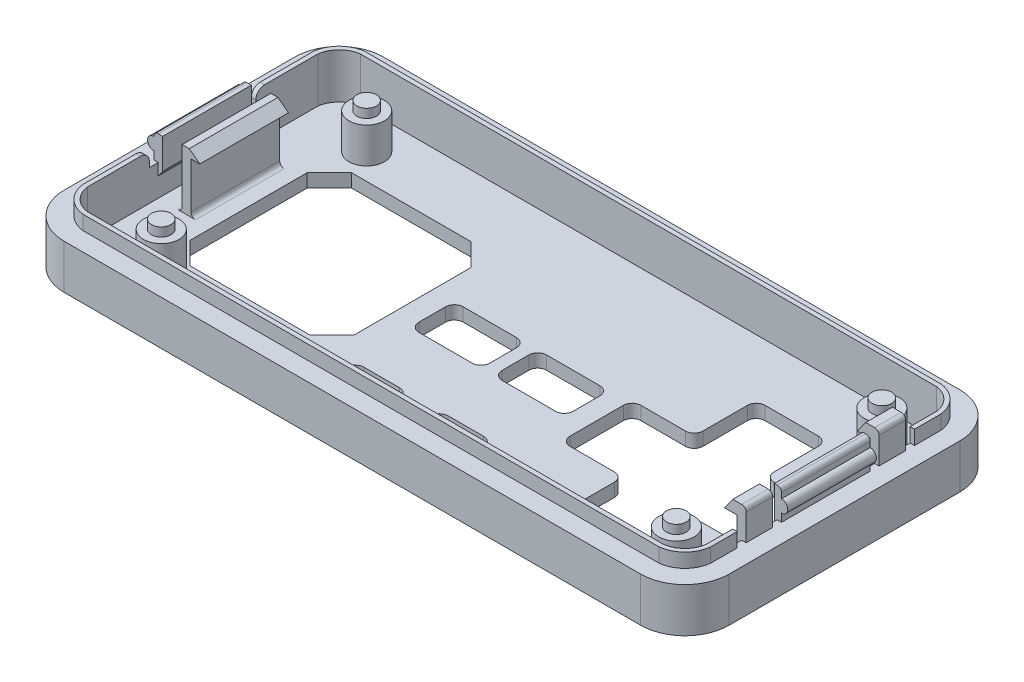
from build123d import *

# Parameters (mm, degrees)
EXTRUDE_2_DEPTH       = 5
EXTRUDE_4_DEPTH       = 1.6
SKETCH_7_W            = 0.5
SKETCH_7_H            = 10
EXTRUDE_8_DEPTH       = 2.8
SKETCH_8_R            = 0.7
EXTRUDE_9_DEPTH       = 10
FILLET_1_R            = 0.5
SKETCH_11_W           = 1
SKETCH_11_H           = 1.6
CUT_EXTRUDE_1_DEPTH   = 1.2
FILLET_2_R            = 1
SKETCH_13_W           = 0.5
SKETCH_13_H           = 10
EXTRUDE_10_DEPTH      = 2.8
CUT_EXTRUDE_START     = -3.5
CUT_EXTRUDE_2_DEPTH   = 3.5
SKETCH_13_2_W         = 0.5
SKETCH_13_2_H         = 10
EXTRUDE_11_DEPTH      = 2
EXTRUDE_12_DEPTH      = 1.6
EXTRUDE_12_DEPTH_BACK = 2
SKETCH_5_W            = 0.3
SKETCH_5_H            = 10
SKETCH_15_R           = 2
EXTRUDE_13_DEPTH      = 4
SKETCH_17_W           = 0.5
SKETCH_17_H           = 1
CUT_EXTRUDE_3_DEPTH   = 1.6
SKETCH_19_W           = 0.8
SKETCH_19_H           = 10
EXTRUDE_15_DEPTH      = 1.8
SKETCH_20_R           = 0.7
EXTRUDE_16_DEPTH      = 10
FILLET_4_R            = 0.5
SKETCH_21_W           = 0.5
SKETCH_21_H           = 3
EXTRUDE_17_DEPTH      = 1.9
SKETCH_22_W           = 3
SKETCH_22_H           = 6.3
EXTRUDE_23_DEPTH      = 0.5
FILLET_12_R           = 0.5
SKETCH_29_W           = 0.5
SKETCH_29_H           = 1
CUT_EXTRUDE_5_DEPTH   = 1.6
SKETCH_30_W           = 3
SKETCH_30_H           = 1.3
EXTRUDE_26_DEPTH      = 1.5
CHAMFER_7_SIZE        = 1
CHAMFER_7_SIZE_2      = 1.37638192
SKETCH_24_W           = 1
SKETCH_24_H           = 10
EXTRUDE_27_DEPTH      = 6.6
FILLET_14_R           = 0.5
SKETCH_31_W           = 10
SKETCH_31_H           = 0.9
EXTRUDE_29_DEPTH      = 1
CHAMFER_9_SIZE        = 1.2
CHAMFER_9_SIZE_2      = 0.90426486
CHAMFER_10_SIZE       = 1
CHAMFER_10_SIZE_2     = 1.37638192
CHAMFER_11_SIZE       = 1
CHAMFER_11_SIZE_2     = 1.37638192
SKETCH_37_R           = 1.1
EXTRUDE_30_DEPTH      = 1
SKETCH_38_W           = 18.5
SKETCH_38_H           = 18.2
CUT_EXTRUDE_6_DEPTH   = 2
CHAMFER_12_SIZE       = 2.5
SKETCH_39_W           = 8
SKETCH_39_H           = 5
SKETCH_39_W_2         = 6
SKETCH_39_H_2         = 4
CUT_EXTRUDE_7_DEPTH   = 2
FILLET_15_R           = 1
CUT_EXTRUDE_8_DEPTH   = 2
FILLET_16_R           = 1
CUT_EXTRUDE_START_2   = -0.8
CUT_EXTRUDE_9_DEPTH   = 0.8


# Read off the part's stored shape, not the designer's step: 切除-拉伸9
# Some blends are built 0.0001 mm under size
with BuildPart() as part:
    # case 2 → 凸台-拉伸2 (new body)
    with BuildSketch(Plane(origin=(0, 0, 0), x_dir=(1, 0, 0), z_dir=(0, 1, 0))):
        with BuildLine():
            Line((-34.042196447, 18), (30.957803553, 18))
            ThreePointArc((30.957803553, 18), (34.493337459, 16.535533906), (35.957803553, 13))
            Line((35.957803553, 13), (35.957803553, -13))
            ThreePointArc((35.957803553, -13), (34.493337459, -16.535533906), (30.957803553, -18))
            Line((30.957803553, -18), (-34.042196447, -18))
            ThreePointArc((-34.042196447, -18), (-37.577730353, -16.535533906), (-39.042196447, -13))
            Line((-39.042196447, -13), (-39.042196447, 13))
            ThreePointArc((-39.042196447, 13), (-37.577730353, 16.535533906), (-34.042196447, 18))
        make_face()
    extrude(amount=EXTRUDE_2_DEPTH)

    # 草图3 → 凸台-拉伸4 (add)
    with BuildSketch(Plane(origin=(0, 5, 0), x_dir=(1, 0, 0), z_dir=(0, 1, 0))):
        with BuildLine():
            Line((-36.942196447, 13), (-36.942196447, -13))
            ThreePointArc((-36.942196447, -13), (-35.997398295, -14.955201848), (-34.042196447, -15.9))
            Line((-34.042196447, -15.9), (30.957803553, -15.9))
            ThreePointArc((30.957803553, -15.9), (32.913005401, -14.955201848), (33.857803553, -13))
            Line((33.857803553, -13), (33.857803553, 13))
            ThreePointArc((33.857803553, 13), (32.913005401, 14.955201848), (30.957803553, 15.9))
            Line((30.957803553, 15.9), (-34.042196447, 15.9))
            ThreePointArc((-34.042196447, 15.9), (-35.997398295, 14.955201848), (-36.942196447, 13))
        make_face()
        with BuildLine():
            Line((-34.042196447, -15.4), (30.957803553, -15.4))
            ThreePointArc((30.957803553, -15.4), (32.562900965, -14.605097413), (33.357803553, -13))
            Line((33.357803553, -13), (33.357803553, 13))
            ThreePointArc((33.357803553, 13), (32.562900965, 14.605097413), (30.957803553, 15.4))
            Line((30.957803553, 15.4), (-34.042196447, 15.4))
            ThreePointArc((-34.042196447, 15.4), (-35.64729386, 14.605097413), (-36.442196447, 13))
            Line((-36.442196447, 13), (-36.442196447, -13))
            ThreePointArc((-36.442196447, -13), (-35.64729386, -14.605097413), (-34.042196447, -15.4))
        make_face(mode=Mode.SUBTRACT)
    extrude(amount=EXTRUDE_4_DEPTH)

    # 草图7 → 凸台-拉伸8 (add)
    with BuildSketch(Plane(origin=(0, 5, 0), x_dir=(1, 0, 0), z_dir=(0, 1, 0))):
        with Locations((-36.692196447, 0)):
            Rectangle(SKETCH_7_W, SKETCH_7_H)
    extrude(amount=EXTRUDE_8_DEPTH)

    # 草图8 → 凸台-拉伸9 (add)
    with BuildSketch(Plane.XY.offset(5)):
        with Locations((-36.942196447, 6.6)):
            Circle(SKETCH_8_R)
    extrude(amount=-EXTRUDE_9_DEPTH)

    # 圆角1
    fillet_1_edges = [part.edges().sort_by_distance(p)[0] for p in [
        (-36.942196447, 7.8, 0),
    ]]
    fillet(fillet_1_edges, radius=FILLET_1_R - 0.0001)  # a hair under: the kernel refuses the full size

    # 草图11 → 切除-拉伸1 (cut)
    with BuildSketch(Plane.ZY.offset(36.942196447)):
        with Locations((5.5, 5.8)):
            Rectangle(SKETCH_11_W, SKETCH_11_H)
        with Locations((-5.5, 5.8)):
            Rectangle(SKETCH_11_W, SKETCH_11_H)
    extrude(amount=-CUT_EXTRUDE_1_DEPTH, mode=Mode.SUBTRACT)

    # 圆角2
    fillet_2_edges = [part.edges().sort_by_distance(p)[0] for p in [
        (-36.692196447, 6.6, 6),
        (-36.692196447, 6.6, -6),
    ]]
    fillet(fillet_2_edges, radius=FILLET_2_R)

    # 草图13 → 凸台-拉伸10 (add)
    with BuildSketch(Plane(origin=(0, 5, 0), x_dir=(1, 0, 0), z_dir=(0, 1, 0))):
        with Locations((-36.192196447, 0)):
            Rectangle(SKETCH_13_W, SKETCH_13_H)
    extrude(amount=EXTRUDE_10_DEPTH)

    # 草图14 → 切除-拉伸2 (cut)
    with BuildSketch(Plane(origin=(0, 5, 0), x_dir=(1, 0, 0), z_dir=(0, 1, 0)).offset(CUT_EXTRUDE_START)):
        with BuildLine():
            Line((-34.042196447, -15.4), (30.957803553, -15.4))
            ThreePointArc((30.957803553, -15.4), (32.562900965, -14.605097413), (33.357803553, -13))
            Line((33.357803553, -13), (33.357803553, 13))
            ThreePointArc((33.357803553, 13), (32.562900965, 14.605097413), (30.957803553, 15.4))
            Line((30.957803553, 15.4), (-34.042196447, 15.4))
            ThreePointArc((-34.042196447, 15.4), (-35.64729386, 14.605097413), (-36.442196447, 13))
            Line((-36.442196447, 13), (-36.442196447, -13))
            ThreePointArc((-36.442196447, -13), (-35.64729386, -14.605097413), (-34.042196447, -15.4))
        make_face()
    extrude(amount=CUT_EXTRUDE_2_DEPTH, mode=Mode.SUBTRACT)

    # 草图13<2> → 凸台-拉伸11 (add)
    with BuildSketch(Plane(origin=(0, 5, 0), x_dir=(1, 0, 0), z_dir=(0, 1, 0))):
        with Locations((-36.192196447, 0)):
            Rectangle(SKETCH_13_2_W, SKETCH_13_2_H)
    extrude(amount=-EXTRUDE_11_DEPTH)

    # 草图5 → 凸台-拉伸12 (add, two sides: drawn at the far end of the back side and taken through both)
    with BuildSketch(Plane(origin=(0, 5, 0), x_dir=(1, 0, 0), z_dir=(0, 1, 0)).offset(-EXTRUDE_12_DEPTH_BACK)):
        with Locations((33.207803553, 0)):
            Rectangle(SKETCH_5_W, SKETCH_5_H)
    extrude(amount=EXTRUDE_12_DEPTH + EXTRUDE_12_DEPTH_BACK)

    # 草图15 → 凸台-拉伸13 (add)
    with BuildSketch(Plane(origin=(0, 1.5, 0), x_dir=(1, 0, 0), z_dir=(0, 1, 0))):
        with Locations(Location((-29.253680869, 11.322457703, 0), (0, 0, 270))):
            Circle(SKETCH_15_R)
        with Locations(Location((28.846319131, 11.322457703, 0), (0, 0, 270))):
            Circle(SKETCH_15_R)
        with Locations(Location((28.846319131, -11.847542297, 0), (0, 0, 270))):
            Circle(SKETCH_15_R)
        with Locations(Location((-29.253680869, -11.847542297, 0), (0, 0, 270))):
            Circle(SKETCH_15_R)
    extrude(amount=EXTRUDE_13_DEPTH)

    # 草图17 → 切除-拉伸3 (cut)
    with BuildSketch(Plane(origin=(0, 6.6, 0), x_dir=(1, 0, 0), z_dir=(0, 1, 0))):
        with Locations((33.607803553, -5.5)):
            Rectangle(SKETCH_17_W, SKETCH_17_H)
        with Locations((33.607803553, 5.5)):
            Rectangle(SKETCH_17_W, SKETCH_17_H)
    extrude(amount=-CUT_EXTRUDE_3_DEPTH, mode=Mode.SUBTRACT)

    # 草图19 → 凸台-拉伸15 (add)
    with BuildSketch(Plane(origin=(0, 6.6, 0), x_dir=(1, 0, 0), z_dir=(0, 1, 0))):
        with Locations((33.457803553, 0)):
            Rectangle(SKETCH_19_W, SKETCH_19_H)
    extrude(amount=EXTRUDE_15_DEPTH)

    # 草图20 → 凸台-拉伸16 (add)
    with BuildSketch(Plane(origin=(0, 0, -5), x_dir=(-1, 0, 0), z_dir=(0, 0, -1))):
        with Locations((-33.857803553, 6.6)):
            Circle(SKETCH_20_R)
    extrude(amount=-EXTRUDE_16_DEPTH)

    # 圆角4
    fillet_4_edges = [part.edges().sort_by_distance(p)[0] for p in [
        (33.857803553, 8.4, 0),
    ]]
    fillet(fillet_4_edges, radius=FILLET_4_R)

    # 草图21 → 凸台-拉伸17 (add)
    with BuildSketch(Plane(origin=(0, 6.6, 0), x_dir=(1, 0, 0), z_dir=(0, 1, 0))):
        with Locations((33.607803553, -7.5)):
            Rectangle(SKETCH_21_W, SKETCH_21_H)
        with Locations((33.607803553, 7.5)):
            Rectangle(SKETCH_21_W, SKETCH_21_H)
    extrude(amount=EXTRUDE_17_DEPTH)

    # 草图22 → 凸台-拉伸23 (add)
    with BuildSketch(Plane.ZY.offset(-33.357803553)):
        with Locations((-7.5, 5.35)):
            Rectangle(SKETCH_22_W, SKETCH_22_H)
        with Locations((7.5, 5.35)):
            Rectangle(SKETCH_22_W, SKETCH_22_H)
    extrude(amount=EXTRUDE_23_DEPTH)

    # 圆角12
    fillet_12_edges = [part.edges().sort_by_distance(p)[0] for p in [
        (33.857803553, 8.5, 7.5),
        (33.857803553, 8.5, -7.5),
    ]]
    fillet(fillet_12_edges, radius=FILLET_12_R)

    # 草图29 → 切除-拉伸5 (cut)
    with BuildSketch(Plane(origin=(0, 6.6, 0), x_dir=(1, 0, 0), z_dir=(0, 1, 0))):
        with Locations((33.607803553, -9.5)):
            Rectangle(SKETCH_29_W, SKETCH_29_H)
        with Locations((33.607803553, 9.5)):
            Rectangle(SKETCH_29_W, SKETCH_29_H)
    extrude(amount=-CUT_EXTRUDE_5_DEPTH, mode=Mode.SUBTRACT)

    # 草图30 → 凸台-拉伸26 (add)
    with BuildSketch(Plane.ZY.offset(-32.857803553)):
        with Locations((7.5, 7.85)):
            Rectangle(SKETCH_30_W, SKETCH_30_H)
        with Locations((-7.5, 7.85)):
            Rectangle(SKETCH_30_W, SKETCH_30_H)
    extrude(amount=EXTRUDE_26_DEPTH)

    # 倒角7
    # the kernel refuses this chamfer: 1.37638192, 1 mm, written as the material it takes off along each edge
    with BuildSketch(Plane(origin=(31.357803553, 8.5, -12.553227563), x_dir=(0.9990705747005861, 0.04310437063037558, 0), z_dir=(0, 0, 1)), Plane(origin=(31.357803553, 8.5, 2.446772437), x_dir=(0.9990705747005861, 0.04310437063037558, 0), z_dir=(0, 0, 1))) as chamfer_7_piece_1:
        Polygon((CHAMFER_7_SIZE * 0.999070574701, -CHAMFER_7_SIZE * 0.0431043706304), (-CHAMFER_7_SIZE_2 * 0.0431043706451, -CHAMFER_7_SIZE_2 * 0.999070575043), (0, 0), align=None)
    extrude(amount=10.106455125, mode=Mode.SUBTRACT)

    # 草图24 → 凸台-拉伸27 (add)
    with BuildSketch(Plane(origin=(0, 1.5, 0), x_dir=(1, 0, 0), z_dir=(0, 1, 0))):
        with Locations((-33.242196447, 0)):
            Rectangle(SKETCH_24_W, SKETCH_24_H)
    extrude(amount=EXTRUDE_27_DEPTH)

    # 圆角14
    fillet_14_edges = [part.edges().sort_by_distance(p)[0] for p in [
        (-33.742196447, 1.5, 0),
        (-32.742196447, 1.5, 0),
    ]]
    fillet(fillet_14_edges, radius=FILLET_14_R)

    # 草图31 → 凸台-拉伸29 (add)
    with BuildSketch(Plane(origin=(-32.742196447, 0, 0), x_dir=(0, 0, -1), z_dir=(1, 0, 0))):
        with Locations((0, 7.65)):
            Rectangle(SKETCH_31_W, SKETCH_31_H)
    extrude(amount=EXTRUDE_29_DEPTH)

    # 倒角9
    # the kernel refuses this chamfer: 1.2, 0.90426486 mm, written as the material it takes off along each edge
    with BuildSketch(Plane(origin=(-31.742196447, 8.1, 8.096678473), x_dir=(-0.9997280272590685, 0.023321052992757905, 0), z_dir=(0, 0, -1))) as chamfer_9_piece_1:
        Polygon((CHAMFER_9_SIZE * 0.999728027259, -CHAMFER_9_SIZE * 0.0233210529928), (-CHAMFER_9_SIZE_2 * 0.0233210529959, -CHAMFER_9_SIZE_2 * 0.999728027395), (0, 0), align=None)
    extrude(amount=16.193356947, mode=Mode.SUBTRACT)

    # 倒角10
    # the kernel refuses this chamfer: 1.37638192, 1 mm, written as the material it takes off along each edge
    with BuildSketch(Plane(origin=(32.857803553, 2.2, 12.553227563), x_dir=(0.9990705747005859, -0.04310437063037643, 0), z_dir=(0, 0, -1))) as chamfer_10_piece_1_section:
        Polygon((CHAMFER_10_SIZE * 0.999070574701, -CHAMFER_10_SIZE * 0.0431043706304), (-CHAMFER_10_SIZE_2 * 0.0431043706451, -CHAMFER_10_SIZE_2 * 0.999070575043), (0, 0), align=None)
    chamfer_10_piece_1 = extrude(amount=10.106455125, mode=Mode.PRIVATE)
    chamfer_10_piece_1 = split(chamfer_10_piece_1, bisect_by=Plane(origin=(33.357803553, 2.593003931, 7.5), z_dir=(-1, 0, 0)), keep=Keep.TOP, mode=Mode.PRIVATE)
    add(chamfer_10_piece_1, mode=Mode.SUBTRACT)
    with BuildSketch(Plane(origin=(33.057803553, 3, 8.553227563), x_dir=(0.9990705747005859, -0.04310437063037643, 0), z_dir=(0, 0, -1))) as chamfer_10_piece_2_section:
        Polygon((CHAMFER_10_SIZE * 0.999070574701, -CHAMFER_10_SIZE * 0.0431043706304), (-CHAMFER_10_SIZE_2 * 0.0431043706451, -CHAMFER_10_SIZE_2 * 0.999070575043), (0, 0), align=None)
    chamfer_10_piece_2 = extrude(amount=13.553227563, mode=Mode.PRIVATE)
    chamfer_10_piece_2 = split(chamfer_10_piece_2, bisect_by=Plane(origin=(33.357803553, 3.591034589, 0), z_dir=(-1, 0, 0)), keep=Keep.TOP, mode=Mode.PRIVATE)
    chamfer_10_piece_2 = split(chamfer_10_piece_2, bisect_by=Plane(origin=(33.198980023, 3.591034589, 6), z_dir=(0, 0, -1)), keep=Keep.TOP, mode=Mode.PRIVATE)
    add(chamfer_10_piece_2, mode=Mode.SUBTRACT)
    with BuildSketch(Plane(origin=(32.857803553, 2.2, -2.446772437), x_dir=(0.9990705747005859, -0.04310437063037643, 0), z_dir=(0, 0, -1))) as chamfer_10_piece_3_section:
        Polygon((CHAMFER_10_SIZE * 0.999070574701, -CHAMFER_10_SIZE * 0.0431043706304), (-CHAMFER_10_SIZE_2 * 0.0431043706451, -CHAMFER_10_SIZE_2 * 0.999070575043), (0, 0), align=None)
    chamfer_10_piece_3 = extrude(amount=10.106455125, mode=Mode.PRIVATE)
    chamfer_10_piece_3 = split(chamfer_10_piece_3, bisect_by=Plane(origin=(33.357803553, 3.100368512, -3.723386219), z_dir=(-1, 0, 0)), keep=Keep.TOP, mode=Mode.PRIVATE)
    add(chamfer_10_piece_3, mode=Mode.SUBTRACT)

    # 倒角11
    # the kernel refuses this chamfer: 1.37638192, 1 mm, written as the material it takes off along each edge
    with BuildSketch(Plane(origin=(-35.942196447, 3, 8.553227563), x_dir=(-0.9990705747005859, -0.04310437063037643, 0), z_dir=(0, 0, -1))) as chamfer_11_piece_1_section:
        Polygon((CHAMFER_11_SIZE * 0.999070574701, CHAMFER_11_SIZE * 0.0431043706304), (-CHAMFER_11_SIZE_2 * 0.0431043706451, CHAMFER_11_SIZE_2 * 0.999070575043), (0, 0), align=None)
    chamfer_11_piece_1 = extrude(amount=17.106455125, mode=Mode.PRIVATE)
    chamfer_11_piece_1 = split(chamfer_11_piece_1, bisect_by=Plane(origin=(-36.442196447, 3.546250957, 0), z_dir=(1, 0, 0)), keep=Keep.TOP, mode=Mode.PRIVATE)
    add(chamfer_11_piece_1, mode=Mode.SUBTRACT)

    # 草图37 → 凸台-拉伸30 (add)
    with BuildSketch(Plane(origin=(0, 5.5, 0), x_dir=(1, 0, 0), z_dir=(0, 1, 0))):
        with Locations(Location((28.846319131, 11.322457703, 0), (0, 0, 270))):
            Circle(SKETCH_37_R)
        with Locations(Location((-29.253680869, 11.322457703, 0), (0, 0, 270))):
            Circle(SKETCH_37_R)
        with Locations(Location((-29.253680869, -11.847542297, 0), (0, 0, 270))):
            Circle(SKETCH_37_R)
        with Locations(Location((28.846319131, -11.847542297, 0), (0, 0, 270))):
            Circle(SKETCH_37_R)
    extrude(amount=EXTRUDE_30_DEPTH)

    # 草图38 → 切除-拉伸6 (cut)
    with BuildSketch(Plane.XZ):
        with Locations((-21.292196447, 0.7)):
            Rectangle(SKETCH_38_W, SKETCH_38_H)
    extrude(amount=-CUT_EXTRUDE_6_DEPTH, mode=Mode.SUBTRACT)

    # 倒角12
    chamfer_12_edges = [part.edges().sort_by_distance(p)[0] for p in [
        (-30.542196447, 0.75, -8.4),
        (-30.542196447, 0.75, 9.8),
        (-12.042196447, 0.75, 9.8),
        (-12.042196447, 0.75, -8.4),
    ]]
    chamfer(chamfer_12_edges, length=CHAMFER_12_SIZE)

    # 草图39 → 切除-拉伸7 (cut)
    with BuildSketch(Plane.XZ):
        with Locations((-5.642196447, 0.9)):
            Rectangle(SKETCH_39_W, SKETCH_39_H)
        with Locations((3.757803553, 0.9)):
            Rectangle(SKETCH_39_W, SKETCH_39_H)
        with Locations((-6.342196447, 11.9)):
            Rectangle(SKETCH_39_W_2, SKETCH_39_H_2)
        with Locations((3.157803553, 11.9)):
            Rectangle(SKETCH_39_W_2, SKETCH_39_H_2)
    extrude(amount=-CUT_EXTRUDE_7_DEPTH, mode=Mode.SUBTRACT)

    # 圆角15
    fillet_15_edges = [part.edges().sort_by_distance(p)[0] for p in [
        (-0.242196447, 0.75, -1.6),
        (-0.242196447, 0.75, 3.4),
        (7.757803553, 0.75, 3.4),
        (7.757803553, 0.75, -1.6),
        (-9.342196447, 0.75, 9.9),
        (-9.342196447, 0.75, 13.9),
        (-3.342196447, 0.75, 13.9),
        (-3.342196447, 0.75, 9.9),
        (0.157803553, 0.75, 9.9),
        (0.157803553, 0.75, 13.9),
        (6.157803553, 0.75, 13.9),
        (6.157803553, 0.75, 9.9),
        (-9.642196447, 0.75, -1.6),
        (-9.642196447, 0.75, 3.4),
        (-1.642196447, 0.75, 3.4),
        (-1.642196447, 0.75, -1.6),
    ]]
    fillet(fillet_15_edges, radius=FILLET_15_R)

    # 草图41 → 切除-拉伸8 (cut)
    with BuildSketch(Plane.XZ):
        Polygon((17.007803553, 13), (25.007803553, 13), (25.007803553, 6), (32.007803553, 6), (32.007803553, -2), (25.007803553, -2), (25.007803553, -9), (17.007803553, -9), (17.007803553, -2), (10.007803553, -2), (10.007803553, 6), (17.007803553, 6), align=None)
    extrude(amount=-CUT_EXTRUDE_8_DEPTH, mode=Mode.SUBTRACT)

    # 圆角16
    fillet_16_edges = [part.edges().sort_by_distance(p)[0] for p in [
        (17.007803553, 0.75, 6),
        (17.007803553, 0.75, 13),
        (25.007803553, 0.75, 13),
        (25.007803553, 0.75, 6),
        (32.007803553, 0.75, 6),
        (32.007803553, 0.75, -2),
        (25.007803553, 0.75, -2),
        (25.007803553, 0.75, -9),
        (17.007803553, 0.75, -9),
        (17.007803553, 0.75, -2),
        (10.007803553, 0.75, -2),
        (10.007803553, 0.75, 6),
    ]]
    fillet(fillet_16_edges, radius=FILLET_16_R)

    # 切除-拉伸9 outline → 切除-拉伸9 (cut)
    with BuildSketch(Plane.XZ.offset(CUT_EXTRUDE_START_2)):
        with BuildLine():
            Line((30.087658574, -9.774806648), (29.800106724, -9.60705588))
            add(Edge.make_bspline(
                [(29.800106724, -9.60705588), (29.706230649, -9.555144922), (29.602408733, -9.527184429), (29.394716145, -9.527184429), (29.290869852, -9.555144922), (29.197018154, -9.60705588)],
                knots=[3, 3, 3, 3, 4, 4, 5, 5, 5, 5], degree=3))
            Line((29.197018154, -9.60705588), (28.909441927, -9.774806648))
            Line((28.909441927, -9.774806648), (27.417711857, -10.635499844))
            Line((27.417711857, -10.635499844), (27.13013563, -10.801251692))
            add(Edge.make_bspline(
                [(27.13013563, -10.801251692), (26.944431155, -10.909083636), (26.828591345, -11.108780546), (26.828591345, -11.322457703)],
                knots=[8, 8, 8, 8, 9, 9, 9, 9], degree=3))
            Line((26.828591345, -11.322457703), (26.828591345, -13.710837139))
            add(Edge.make_bspline(
                [(26.828591345, -13.710837139), (26.828591345, -13.926501027), (26.944431155, -14.124211206), (27.13013563, -14.23204315)],
                knots=[10, 10, 10, 10, 11, 11, 11, 11], degree=3))
            Line((27.13013563, -14.23204315), (27.417711857, -14.397794998))
            Line((27.417711857, -14.397794998), (28.909441927, -15.258488195))
            Line((28.909441927, -15.258488195), (29.197018154, -15.426226774))
            add(Edge.make_bspline(
                [(29.197018154, -15.426226774), (29.290869852, -15.48014884), (29.394716145, -15.506110413), (29.602408733, -15.506110413), (29.706230649, -15.48014884), (29.800106724, -15.426226774)],
                knots=[14, 14, 14, 14, 15, 15, 16, 16, 16, 16], degree=3))
            Line((29.800106724, -15.426226774), (30.087658574, -15.258488195))
            Line((30.087658574, -15.258488195), (31.579388644, -14.397794998))
            Line((31.579388644, -14.397794998), (31.866940494, -14.23204315))
            add(Edge.make_bspline(
                [(31.866940494, -14.23204315), (32.054668266, -14.124211206), (32.168484779, -13.926501027), (32.168484779, -13.710837139)],
                knots=[19, 19, 19, 19, 20, 20, 20, 20], degree=3))
            Line((32.168484779, -13.710837139), (32.168484779, -11.322457703))
            add(Edge.make_bspline(
                [(32.168484779, -11.322457703), (32.168484779, -11.108780546), (32.054668266, -10.909083636), (31.866940494, -10.801251692)],
                knots=[21, 21, 21, 21, 22, 22, 22, 22], degree=3))
            Line((31.866940494, -10.801251692), (31.579388644, -10.635499844))
            Line((31.579388644, -10.635499844), (30.087658574, -9.774806648))
        make_face()
        with BuildLine():
            add(Edge.make_bspline(
                [(30.223438822, -13.804688836), (30.451120602, -13.676879889), (30.558940357, -13.509141309), (30.558940357, -13.123727735), (30.435129248, -13.125726654), (30.211469683, -13.253523414)],
                knots=[0, 0, 0, 0, 1, 1, 2.031545133, 2.031545133, 2.031545133, 2.031545133], degree=3))
            Line((30.211469683, -13.253523414), (30.039733266, -13.349386219))
            add(Edge.make_bspline(
                [(30.019744073, -13.383331281), (30.019744073, -13.369351034), (30.02773975, -13.355370788), (30.039733266, -13.349386219)],
                knots=[4, 4, 4, 4, 5, 5, 5, 5], degree=3))
            Line((30.019744073, -13.383331281), (30.019744073, -14.909018601))
            add(Edge.make_bspline(
                [(29.999803634, -14.942963663), (30.013771692, -14.934980175), (30.019744073, -14.922998848), (30.019744073, -14.909018601)],
                knots=[3, 3, 3, 3, 4, 4, 4, 4], degree=3))
            Line((29.999803634, -14.942963663), (29.612378952, -15.162625389))
            add(Edge.make_bspline(
                [(29.554459047, -15.128680327), (29.554459047, -15.158639739), (29.586417379, -15.176605636), (29.612378952, -15.162625389)],
                knots=[5, 5, 5, 5, 6, 6, 6, 6], degree=3))
            Line((29.554459047, -15.128680327), (29.554459047, -13.279484987))
            add(Edge.make_bspline(
                [(29.574423863, -13.245539925), (29.560455805, -13.251524494), (29.554459047, -13.265504741), (29.554459047, -13.279484987)],
                knots=[7, 7, 7, 7, 8, 8, 8, 8], degree=3))
            Line((29.574423863, -13.245539925), (30.233433418, -12.872107678))
            add(Edge.make_bspline(
                [(30.233433418, -12.872107678), (30.660787732, -12.630470028), (31.014230786, -12.58254472), (31.014230786, -13.523121556), (30.656789893, -13.928499946), (30.247425853, -14.160155187)],
                knots=[9, 9, 9, 9, 10, 10, 10.962489192, 10.962489192, 10.962489192, 10.962489192], degree=3))
            Line((30.247425853, -14.160155187), (30.039733266, -14.27597062))
            Line((30.039733266, -14.27597062), (30.039733266, -13.896553803))
            Line((30.039733266, -13.896553803), (30.223438822, -13.804688836))
        make_face(mode=Mode.SUBTRACT)
        with BuildLine():
            add(Edge.make_bspline(
                [(31.615320437, -14.036344078), (31.627313952, -14.03034732), (31.635309629, -14.016367074), (31.635309629, -14.002386828)],
                knots=[0, 0, 0, 0, 1, 1, 1, 1], degree=3))
            Line((31.615320437, -14.036344078), (31.23191797, -14.254006885))
            add(Edge.make_bspline(
                [(31.173998065, -14.220061823), (31.173998065, -14.250009046), (31.205956397, -14.267987131), (31.23191797, -14.254006885)],
                knots=[2, 2, 2, 2, 3, 3, 3, 3], degree=3))
            Line((31.173998065, -14.220061823), (31.173998065, -13.339391622))
            add(Edge.make_bspline(
                [(31.193987258, -13.305446561), (31.181993742, -13.313430049), (31.173998065, -13.325423565), (31.173998065, -13.339391622)],
                knots=[4, 4, 4, 4, 5, 5, 5, 5], degree=3))
            Line((31.193987258, -13.305446561), (31.577389725, -13.089770485))
            add(Edge.make_bspline(
                [(31.635309629, -13.123727735), (31.635309629, -13.093768323), (31.603351298, -13.075802427), (31.577389725, -13.089770485)],
                knots=[6, 6, 6, 6, 7, 7, 7, 7], degree=3))
            Line((31.635309629, -13.123727735), (31.635309629, -14.002386828))
        make_face(mode=Mode.SUBTRACT)
        with BuildLine():
            add(Edge.make_bspline(
                [(31.405653307, -12.50466), (31.249908243, -12.592527128), (31.140065192, -12.752282218), (31.140065192, -12.894071413), (31.140065192, -13.031862768), (31.249908243, -13.069805669), (31.405653307, -12.979939622)],
                knots=[0, 0, 0, 0, 1, 1, 1, 2, 2, 2, 2], degree=3))
            add(Edge.make_bspline(
                [(31.405653307, -12.979939622), (31.559423828, -12.894071413), (31.669242503, -12.732317403), (31.669242503, -12.594526047), (31.669242503, -12.454735772), (31.559423828, -12.416792872), (31.405653307, -12.50466)],
                knots=[2, 2, 2, 2, 3, 3, 3, 4, 4, 4, 4], degree=3))
        make_face(mode=Mode.SUBTRACT)
        with BuildLine():
            add(Edge.make_bspline(
                [(29.304837909, -12.352888398), (29.42465118, -12.422789629), (29.574423863, -12.422789629), (29.694261511, -12.352888398)],
                knots=[7, 7, 7, 7, 8, 8, 8, 8], degree=3))
            add(Edge.make_bspline(
                [(27.495596577, -11.308477457), (27.499594416, -11.310476376), (29.304837909, -12.352888398)],
                knots=[0, 0, 0, 1, 1, 1], degree=2))
            add(Edge.make_bspline(
                [(27.513562474, -11.038891503), (27.411715099, -11.096799219), (27.40174488, -11.240587333), (27.495596577, -11.308477457)],
                knots=[1, 1, 1, 1, 2, 2, 2, 2], degree=3))
            Line((27.513562474, -11.038891503), (29.358759976, -9.972504639))
            add(Edge.make_bspline(
                [(29.640339445, -9.972504639), (29.552484505, -9.922580411), (29.444640373, -9.922580411), (29.358759976, -9.972504639)],
                knots=[3, 3, 3, 3, 4, 4, 4, 4], degree=3))
            Line((29.640339445, -9.972504639), (31.47554235, -11.040890422))
            add(Edge.make_bspline(
                [(31.477541269, -11.286513722), (31.571392967, -11.230592736), (31.569394048, -11.0948003), (31.47554235, -11.040890422)],
                knots=[5, 5, 5, 5, 6, 6, 6, 6], degree=3))
            Line((31.477541269, -11.286513722), (29.694261511, -12.352888398))
        make_face(mode=Mode.SUBTRACT)
    extrude(amount=CUT_EXTRUDE_9_DEPTH, mode=Mode.SUBTRACT)


solid = part.part
